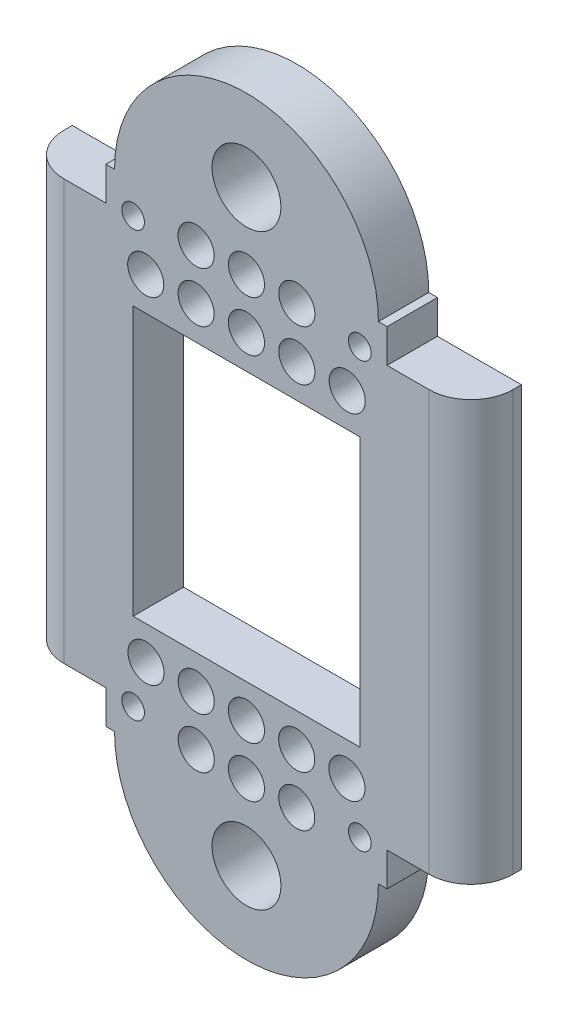
from build123d import *

# Parameters (mm, degrees)
SKETCH1_R           = 1.35
SKETCH1_R_2         = 4.1
SKETCH1_W           = 27
SKETCH1_H           = 32
BOSS_EXTRUDE1_DEPTH = 6
SKETCH2_R           = 2.15
CUT_EXTRUDE1_DEPTH  = 4.2
FILLET1_R           = 5
FILLET2_R           = 5


with BuildPart() as part:
    # Sketch1 → Boss-Extrude1 (new body)
    with BuildSketch(Plane.XY):
        with BuildLine():
            Line((-16.75, 29), (-15.715411776, 29))
            ThreePointArc((-15.715411776, 29), (0, 44.715411776), (15.715411776, 29))
            Line((15.715411776, 29), (16.75, 29))
            Line((16.75, 29), (16.75, 25))
            Line((16.75, 25), (26.75, 25))
            Line((26.75, 25), (26.75, -25))
            Line((26.75, -25), (16.75, -25))
            Line((16.75, -25), (16.75, -29))
            Line((16.75, -29), (15.715411776, -29))
            ThreePointArc((15.715411776, -29), (0, -44.715411776), (-15.715411776, -29))
            Line((-15.715411776, -29), (-16.75, -29))
            Line((-16.75, -29), (-16.75, -25))
            Line((-16.75, -25), (-26.75, -25))
            Line((-26.75, -25), (-26.75, 25))
            Line((-26.75, 25), (-16.75, 25))
            Line((-16.75, 25), (-16.75, 29))
        make_face()
        with Locations((-13.5, 25.3)):
            Circle(SKETCH1_R, mode=Mode.SUBTRACT)
        with Locations((13.5, -25.3)):
            Circle(SKETCH1_R, mode=Mode.SUBTRACT)
        with Locations((-13.5, -25.3)):
            Circle(SKETCH1_R, mode=Mode.SUBTRACT)
        with Locations((13.5, 25.3)):
            Circle(SKETCH1_R, mode=Mode.SUBTRACT)
        with Locations((0, 35)):
            Circle(SKETCH1_R_2, mode=Mode.SUBTRACT)
        with Locations((0, -35)):
            Circle(SKETCH1_R_2, mode=Mode.SUBTRACT)
        Rectangle(SKETCH1_W, SKETCH1_H, mode=Mode.SUBTRACT)
    extrude(amount=BOSS_EXTRUDE1_DEPTH)

    # Sketch2 → Cut-Extrude1 (cut)
    with BuildSketch(Plane.XY.offset(6)):
        with Locations((-12, 20)):
            Circle(SKETCH2_R)
        with Locations((-6, 20)):
            Circle(SKETCH2_R)
        with Locations((0, 20)):
            Circle(SKETCH2_R)
        with Locations((6, 20)):
            Circle(SKETCH2_R)
        with Locations((12, 20)):
            Circle(SKETCH2_R)
        with Locations((-6, 26)):
            Circle(SKETCH2_R)
        with Locations((0, 26)):
            Circle(SKETCH2_R)
        with Locations((6, 26)):
            Circle(SKETCH2_R)
        with Locations((-11.967349369, -20)):
            Circle(SKETCH2_R)
        with Locations((-5.983674685, -20)):
            Circle(SKETCH2_R)
        with Locations((0, -20)):
            Circle(SKETCH2_R)
        with Locations((5.983674685, -20)):
            Circle(SKETCH2_R)
        with Locations((11.967349369, -20)):
            Circle(SKETCH2_R)
        with Locations((-5.983674685, -26)):
            Circle(SKETCH2_R)
        with Locations((0, -26)):
            Circle(SKETCH2_R)
        with Locations((5.983674685, -26)):
            Circle(SKETCH2_R)
    extrude(amount=-CUT_EXTRUDE1_DEPTH, mode=Mode.SUBTRACT)

    # Fillet1
    fillet1_edges = [part.edges().sort_by_distance(p)[0] for p in [
        (-26.75, 0, 6),
    ]]
    fillet(fillet1_edges, radius=FILLET1_R)

    # Fillet2
    fillet2_edges = [part.edges().sort_by_distance(p)[0] for p in [
        (26.75, 0, 6),
    ]]
    fillet(fillet2_edges, radius=FILLET2_R)


solid = part.part
